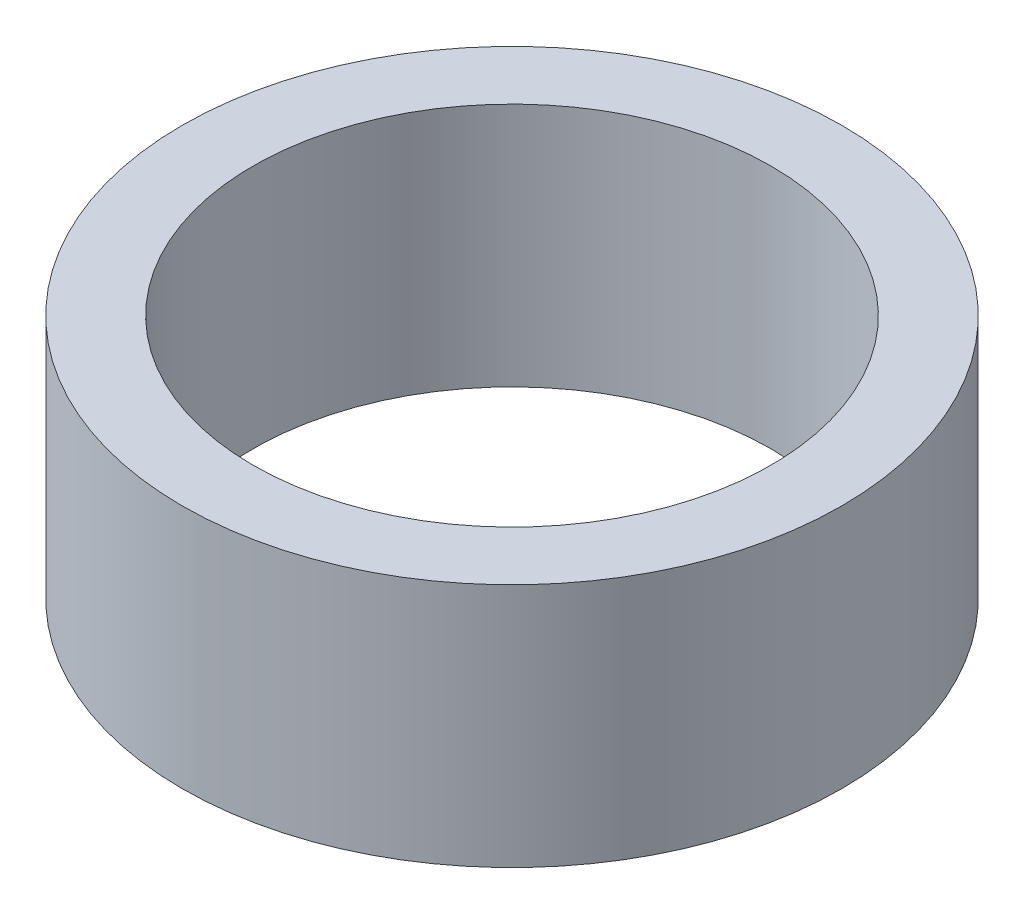
from build123d import *

# Parameters (mm, degrees)
SKETCH1_R           = 35
BOSS_EXTRUDE1_DEPTH = 26
SKETCH2_R           = 27.5
CUT_EXTRUDE1_DEPTH  = 56.910642994


with BuildPart() as part:
    # Sketch1 → Boss-Extrude1 (new body)
    with BuildSketch(Plane(origin=(0, 0, 0), x_dir=(1, 0, 0), z_dir=(0, 1, 0))):
        Circle(SKETCH1_R)
    extrude(amount=BOSS_EXTRUDE1_DEPTH)

    # Sketch2 → Cut-Extrude1 (cut, through all)
    with BuildSketch(Plane(origin=(0, 0, 0), x_dir=(1, 0, 0), z_dir=(0, 1, 0))):
        Circle(SKETCH2_R)
    extrude(amount=CUT_EXTRUDE1_DEPTH, mode=Mode.SUBTRACT)


solid = part.part
